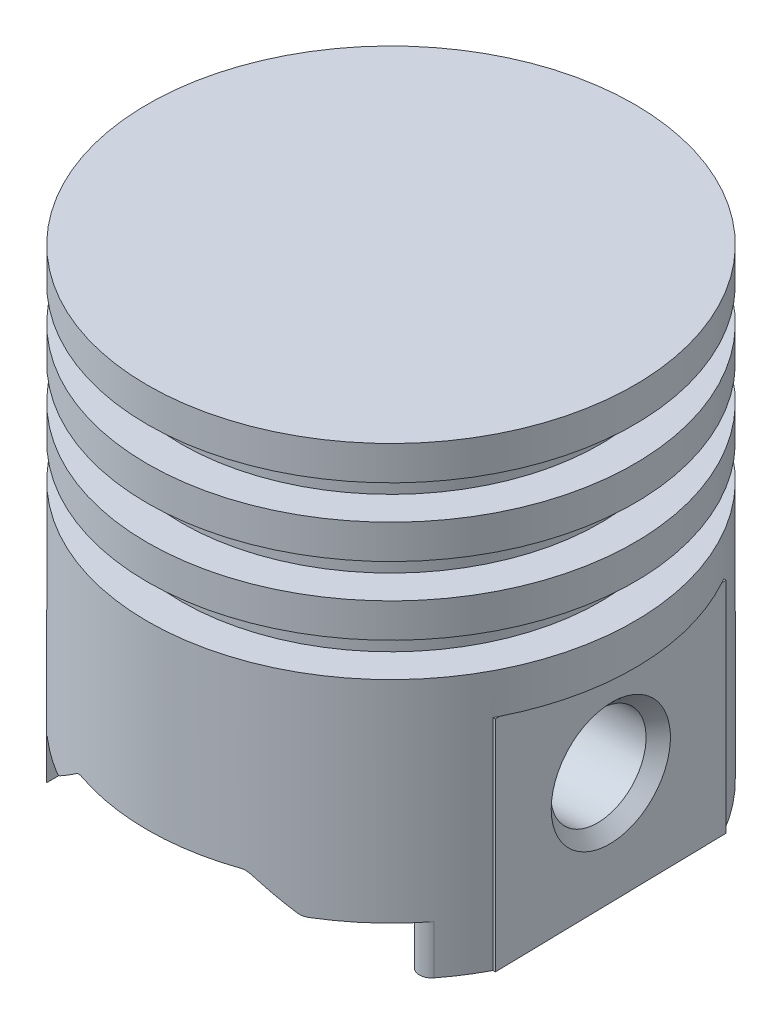
from build123d import *

# Parameters (mm, degrees)
SKETCH2_R               = 85
CUT_EXTRUDE2_DEPTH      = 93
BOSS_EXTRUDE1_START     = 85
SKETCH3_R               = 85
BOSS_EXTRUDE1_DEPTH     = 85
CUT_EXTRUDE3_DEPTH      = 174.061825504
CUT_EXTRUDE3_DEPTH_BACK = 174.061825504
BOSS_EXTRUDE2_DEPTH     = 95.654206
CUT_EXTRUDE7_START      = -90
CUT_EXTRUDE7_DEPTH      = 90
SKETCH11_R              = 25
BOSS_EXTRUDE3_DEPTH     = 90
SKETCH12_W              = 96.789265928
SKETCH12_H              = 90
BOSS_EXTRUDE4_DEPTH     = 1
SKETCH13_W              = 96.789265928
SKETCH13_H              = 90
BOSS_EXTRUDE5_DEPTH     = 1
CUT_EXTRUDE8_START      = -175.541269129
SKETCH14_R              = 20
CUT_EXTRUDE8_DEPTH      = 176.541269129
SKETCH16_R              = 30.208811045
SKETCH16_R_2            = 17.877643793
CUT_EXTRUDE10_DEPTH     = 40
CUT_EXTRUDE11_START     = -64
SKETCH17_R              = 20
CUT_EXTRUDE11_DEPTH     = 64
FILLET1_R               = 10
FILLET3_R               = 5
CHAMFER1_SIZE           = 5


with BuildPart() as part:
    # Revolve-Thin1: read off the stored shape, not the designer's step
    # Revolve-Thin1 outline → Revolve-Thin1 (revolve)
    with BuildSketch(Plane.XY):
        Polygon((0, -89.751668892), (0, -99.751668892), (100, -99.751668892), (100, 6.902536716), (86, 6.902536716), (86, 20.902536716), (100, 20.902536716), (100, 34.902536716), (86, 34.902536716), (86, 48.902536716), (100, 48.902536716), (100, 62.902536716), (86, 62.902536716), (86, 76.902536716), (100, 76.902536716), (100, 90.902536716), (0, 90.902536716), (0, 80.902536716), (76, 80.902536716), (76, -3.097463284), (90, -3.097463284), (90, -89.751668892), align=None)
    revolve(axis=Axis((0, 0, 0), (0, 1, 0)))

    # Sketch2 → Cut-Extrude2 (cut)
    with BuildSketch(Plane.XZ.offset(99.751668892)):
        with Locations(Location((0, 0, 0), (0, 0, 270))):
            Circle(SKETCH2_R)
    extrude(amount=-CUT_EXTRUDE2_DEPTH, mode=Mode.SUBTRACT)

    # Sketch3 → Boss-Extrude1 (add)
    with BuildSketch(Plane.XZ.offset(-80.902536716).offset(BOSS_EXTRUDE1_START)):
        with Locations(Location((0, 0, 0), (0, 0, 270))):
            Circle(SKETCH3_R)
    extrude(amount=-BOSS_EXTRUDE1_DEPTH)

    # Sketch4 → Cut-Extrude3 (cut, two sides: drawn at the far end of the back side and taken through both)
    with BuildSketch(Plane.XY.offset(-CUT_EXTRUDE3_DEPTH_BACK)):
        Polygon((-70, -99.751668892), (70, -99.751668892), (70, -79.751668892), (50, -79.751668892), (34.353026326, -67.294854899), (-34.353026326, -67.294854899), (-50, -79.751668892), (-70, -79.751668892), align=None)
    extrude(amount=CUT_EXTRUDE3_DEPTH + CUT_EXTRUDE3_DEPTH_BACK, mode=Mode.SUBTRACT)

    # Sketch7 → Boss-Extrude2 (add, through all)
    with BuildSketch(Plane.XZ.offset(4.097463284)):
        with BuildLine():
            Line((-70, 48.218253805), (-70, -48.218253805))
            ThreePointArc((-70, -48.218253805), (-85, 0), (-70, 48.218253805))
        make_face()
        with BuildLine():
            Line((70, 48.218253805), (70, -48.218253805))
            ThreePointArc((70, -48.218253805), (85, 0), (70, 48.218253805))
        make_face()
    extrude(amount=BOSS_EXTRUDE2_DEPTH)

    # Sketch9 → Cut-Extrude7 (cut)
    with BuildSketch(Plane.XZ.offset(99.751668892).offset(CUT_EXTRUDE7_START)):
        with BuildLine():
            Line((-88.474503893, 46.607533307), (-86.50893928, -50.161772544))
            ThreePointArc((-86.50893928, -50.161772544), (-99.979377798, -2.030767146), (-88.474503893, 46.607533307))
        make_face()
        with BuildLine():
            Line((88.474503893, 46.607533307), (86.50893928, -50.161772544))
            ThreePointArc((86.50893928, -50.161772544), (99.979377798, -2.030767146), (88.474503893, 46.607533307))
        make_face()
    extrude(amount=CUT_EXTRUDE7_DEPTH, mode=Mode.SUBTRACT)

    # Sketch11 → Boss-Extrude3 (add)
    with BuildSketch(Plane(origin=(87.491721586, 0, -1.777119618), x_dir=(-0.02030767145531355, 0, -0.99979377797627), z_dir=(0.9997937779762701, 0, -0.02030767145531355))):
        with Locations((0, -54.751668892)):
            Circle(SKETCH11_R)
    boss_extrude3 = extrude(amount=-BOSS_EXTRUDE3_DEPTH)

    # Sketch12 → Boss-Extrude4 (add)
    with BuildSketch(Plane(origin=(87.491721586, 0, -1.777119618), x_dir=(-0.02030767145531355, 0, -0.99979377797627), z_dir=(0.9997937779762701, 0, -0.02030767145531355))):
        with Locations((0, -54.751668892)):
            Rectangle(SKETCH12_W, SKETCH12_H)
    boss_extrude4 = extrude(amount=BOSS_EXTRUDE4_DEPTH)

    # Sketch13 → Boss-Extrude5 (add)
    with BuildSketch(Plane(origin=(-87.491721586, 0, -1.777119618), x_dir=(-0.02030767145531355, 0, 0.99979377797627), z_dir=(-0.9997937779762701, 0, -0.02030767145531355))):
        with Locations((0, -54.751668892)):
            Rectangle(SKETCH13_W, SKETCH13_H)
    boss_extrude5 = extrude(amount=BOSS_EXTRUDE5_DEPTH)

    # Sketch14 → Cut-Extrude8 (cut)
    with BuildSketch(Plane(origin=(-2.489718432, 0, 0.050570813), x_dir=(0.020307671455313554, 0, 0.99979377797627), z_dir=(-0.9997937779762701, 0, 0.020307671455313554)).offset(CUT_EXTRUDE8_START)):
        with Locations((0, -53.701162377)):
            Circle(SKETCH14_R)
    cut_extrude8 = extrude(amount=CUT_EXTRUDE8_DEPTH, mode=Mode.SUBTRACT)

    # Sketch16 → Cut-Extrude10 (cut)
    with BuildSketch(Plane(origin=(-2.489718432, 0, 0.050570813), x_dir=(0.020307671455313554, 0, 0.99979377797627), z_dir=(-0.9997937779762701, 0, 0.020307671455313554))):
        with Locations((0, -53.701162377)):
            Circle(SKETCH16_R)
        with Locations((0, -53.701162377)):
            Circle(SKETCH16_R_2, mode=Mode.SUBTRACT)
    cut_extrude10 = extrude(amount=-CUT_EXTRUDE10_DEPTH, mode=Mode.SUBTRACT)

    # Mirror3: Boss-Extrude3, Boss-Extrude4, Boss-Extrude5, Cut-Extrude8, Cut-Extrude10 across plane
    add(boss_extrude3.mirror(Plane(origin=(0, 0, 0), x_dir=(0, 0, 1), z_dir=(1, 0, 0))))
    add(boss_extrude4.mirror(Plane(origin=(0, 0, 0), x_dir=(0, 0, 1), z_dir=(1, 0, 0))))
    add(boss_extrude5.mirror(Plane(origin=(0, 0, 0), x_dir=(0, 0, 1), z_dir=(1, 0, 0))))
    add(cut_extrude8.mirror(Plane(origin=(0, 0, 0), x_dir=(0, 0, 1), z_dir=(1, 0, 0))), mode=Mode.SUBTRACT)
    add(cut_extrude10.mirror(Plane(origin=(0, 0, 0), x_dir=(0, 0, 1), z_dir=(1, 0, 0))), mode=Mode.SUBTRACT)

    # Sketch17 → Cut-Extrude11 (cut)
    with BuildSketch(Plane(origin=(37.502032687, 0, -0.761736045), x_dir=(0.020307671455313557, 0, 0.99979377797627), z_dir=(-0.9997937779762701, 0, 0.020307671455313557)).offset(CUT_EXTRUDE11_START)):
        with Locations((0, -53.701162377)):
            Circle(SKETCH17_R)
    extrude(amount=CUT_EXTRUDE11_DEPTH, mode=Mode.SUBTRACT)

    # Fillet1
    fillet1_edges = [part.edges().sort_by_distance(p)[0] for p in [
        (70, -54.751668892, 23.583326399),
        (-70, -54.751668892, 23.583326399),
    ]]
    fillet(fillet1_edges, radius=FILLET1_R)

    # Fillet3
    # the kernel refuses this fillet: 5 mm, written as the material it adds along each edge
    with BuildSketch(Plane(origin=(-70, -79.751668892, 83.914284285), x_dir=(1, 0, 0), z_dir=(0, 0, -1))) as fillet3_piece_1_section:
        with BuildLine():
            CenterArc((FILLET3_R, FILLET3_R), FILLET3_R, 180, 90)
            Line((0, FILLET3_R), (0, 0))
            Line((0, 0), (FILLET3_R, 0))
        make_face()
    fillet3_piece_1 = extrude(amount=39.845741791, mode=Mode.PRIVATE)
    fillet3_piece_1 = fillet3_piece_1 & Plane(origin=(0, -79.751668892, 0), x_dir=(1, 0, 0), z_dir=(0, 1, 0)) * Cylinder(100, 100, mode=Mode.PRIVATE)
    fillet3_piece_1 = fillet3_piece_1 - Plane(origin=(0, -79.751668892, 0), x_dir=(1, 0, 0), z_dir=(0, -1, 0)) * Cylinder(90, 100, mode=Mode.PRIVATE)
    add(fillet3_piece_1)
    with BuildSketch(Plane(origin=(-70, -79.751668892, -44.068542495), x_dir=(0, -1, 0), z_dir=(0, 0, -1))) as fillet3_piece_2_section:
        with BuildLine():
            CenterArc((FILLET3_R, -FILLET3_R), FILLET3_R, 90, 90)
            Line((0, -FILLET3_R), (0, 0))
            Line((0, 0), (FILLET3_R, 0))
        make_face()
    fillet3_piece_2 = extrude(amount=39.845741791, mode=Mode.PRIVATE)
    fillet3_piece_2 = fillet3_piece_2 & Plane(origin=(0, -79.751668892, 0), x_dir=(1, 0, 0), z_dir=(0, 1, 0)) * Cylinder(100, 100, mode=Mode.PRIVATE)
    fillet3_piece_2 = fillet3_piece_2 - Plane(origin=(0, -79.751668892, 0), x_dir=(1, 0, 0), z_dir=(0, -1, 0)) * Cylinder(90, 100, mode=Mode.PRIVATE)
    add(fillet3_piece_2)
    with BuildSketch(Plane(origin=(-34.353026326, -67.294854899, -98.282278363), x_dir=(-0.7823486836917977, -0.6228406996381269, 0), z_dir=(0, 0, 1))) as fillet3_piece_3_section:
        with BuildLine():
            CenterArc((FILLET3_R * 0.34944941208, FILLET3_R), FILLET3_R, 231.476124538, 38.523875462)
            Line((-FILLET3_R * 0.273391287558, FILLET3_R * 0.217651316308), (0, 0))
            Line((0, 0), (FILLET3_R * 0.34944941208, 0))
        make_face()
    fillet3_piece_3 = extrude(amount=19.464642533, mode=Mode.PRIVATE)
    fillet3_piece_3 = fillet3_piece_3 & Plane(origin=(0, -67.294854899, 0), x_dir=(1, 0, 0), z_dir=(0, 1, 0)) * Cylinder(100, 46, mode=Mode.PRIVATE)
    fillet3_piece_3 = fillet3_piece_3 - Plane(origin=(0, -67.294854899, 0), x_dir=(1, 0, 0), z_dir=(0, -1, 0)) * Cylinder(90, 46, mode=Mode.PRIVATE)
    add(fillet3_piece_3)
    with BuildSketch(Plane(origin=(-34.353026326, -67.294854899, 78.81763583), x_dir=(1, 0, 0), z_dir=(0, 0, 1))) as fillet3_piece_4_section:
        with BuildLine():
            CenterArc((FILLET3_R * 0.34944941208, -FILLET3_R), FILLET3_R, 90, 38.523875462)
            Line((-FILLET3_R * 0.273391287558, -FILLET3_R * 0.217651316308), (0, 0))
            Line((0, 0), (FILLET3_R * 0.34944941208, 0))
        make_face()
    fillet3_piece_4 = extrude(amount=19.464642533, mode=Mode.PRIVATE)
    fillet3_piece_4 = fillet3_piece_4 & Plane(origin=(0, -67.294854899, 0), x_dir=(1, 0, 0), z_dir=(0, 1, 0)) * Cylinder(100, 46, mode=Mode.PRIVATE)
    fillet3_piece_4 = fillet3_piece_4 - Plane(origin=(0, -67.294854899, 0), x_dir=(1, 0, 0), z_dir=(0, -1, 0)) * Cylinder(90, 46, mode=Mode.PRIVATE)
    add(fillet3_piece_4)
    with BuildSketch(Plane(origin=(34.353026326, -67.294854899, -98.282278363), x_dir=(-1, 0, 0), z_dir=(0, 0, 1))) as fillet3_piece_5_section:
        with BuildLine():
            CenterArc((FILLET3_R * 0.34944941208, FILLET3_R), FILLET3_R, 231.476124538, 38.523875462)
            Line((-FILLET3_R * 0.273391287558, FILLET3_R * 0.217651316308), (0, 0))
            Line((0, 0), (FILLET3_R * 0.34944941208, 0))
        make_face()
    fillet3_piece_5 = extrude(amount=19.464642533, mode=Mode.PRIVATE)
    fillet3_piece_5 = fillet3_piece_5 & Plane(origin=(0, -67.294854899, 0), x_dir=(1, 0, 0), z_dir=(0, 1, 0)) * Cylinder(100, 46, mode=Mode.PRIVATE)
    fillet3_piece_5 = fillet3_piece_5 - Plane(origin=(0, -67.294854899, 0), x_dir=(1, 0, 0), z_dir=(0, -1, 0)) * Cylinder(90, 46, mode=Mode.PRIVATE)
    add(fillet3_piece_5)
    with BuildSketch(Plane(origin=(34.353026326, -67.294854899, 78.81763583), x_dir=(0.7823486836917984, -0.6228406996381259, 0), z_dir=(0, 0, 1))) as fillet3_piece_6_section:
        with BuildLine():
            CenterArc((FILLET3_R * 0.34944941208, -FILLET3_R), FILLET3_R, 90, 38.523875462)
            Line((-FILLET3_R * 0.273391287558, -FILLET3_R * 0.217651316308), (0, 0))
            Line((0, 0), (FILLET3_R * 0.34944941208, 0))
        make_face()
    fillet3_piece_6 = extrude(amount=19.464642533, mode=Mode.PRIVATE)
    fillet3_piece_6 = fillet3_piece_6 & Plane(origin=(0, -67.294854899, 0), x_dir=(1, 0, 0), z_dir=(0, 1, 0)) * Cylinder(100, 46, mode=Mode.PRIVATE)
    fillet3_piece_6 = fillet3_piece_6 - Plane(origin=(0, -67.294854899, 0), x_dir=(1, 0, 0), z_dir=(0, -1, 0)) * Cylinder(90, 46, mode=Mode.PRIVATE)
    add(fillet3_piece_6)
    with BuildSketch(Plane(origin=(70, -79.751668892, -83.914284285), x_dir=(0, -1, 0), z_dir=(0, 0, 1))) as fillet3_piece_7_section:
        with BuildLine():
            CenterArc((FILLET3_R, -FILLET3_R), FILLET3_R, 90, 90)
            Line((0, -FILLET3_R), (0, 0))
            Line((0, 0), (FILLET3_R, 0))
        make_face()
    fillet3_piece_7 = extrude(amount=39.845741791, mode=Mode.PRIVATE)
    fillet3_piece_7 = fillet3_piece_7 & Plane(origin=(0, -79.751668892, 0), x_dir=(1, 0, 0), z_dir=(0, 1, 0)) * Cylinder(100, 100, mode=Mode.PRIVATE)
    fillet3_piece_7 = fillet3_piece_7 - Plane(origin=(0, -79.751668892, 0), x_dir=(1, 0, 0), z_dir=(0, -1, 0)) * Cylinder(90, 100, mode=Mode.PRIVATE)
    add(fillet3_piece_7)
    # the kernel refuses this fillet: 5 mm, written as the material it takes off along each edge
    with BuildSketch(Plane(origin=(70, -133.364682754, 71.414284285), x_dir=(0, 0, -1), z_dir=(0, 1, 0))) as fillet3_2_piece_1:
        with BuildLine():
            CenterArc((13.104765337, -5), FILLET3_R, 90, 142.136353638)
            ThreePointArc((10.035843287, -8.947368421), (4.867377351, -4.642542678), (0, 0))
            Line((0, 0), (13.104765337, 0))
        make_face()
    extrude(amount=53.613013862, mode=Mode.SUBTRACT)
    with BuildSketch(Plane(origin=(-50, -79.751668892, 90.970658029), x_dir=(0.7823486836917969, 0.6228406996381279, 0), z_dir=(0, 0, -1)), Plane(origin=(50, -79.751668892, -90.970658029), x_dir=(-0.7823486836917977, 0.6228406996381269, 0), z_dir=(0, 0, 1))) as fillet3_2_piece_2:
        with BuildLine():
            CenterArc((FILLET3_R * 0.34944941208, -FILLET3_R), FILLET3_R, 90, 38.523875462)
            Line((-FILLET3_R * 0.273391287558, -FILLET3_R * 0.217651316308), (0, 0))
            Line((0, 0), (FILLET3_R * 0.34944941208, 0))
        make_face()
    extrude(amount=20.505627945, mode=Mode.SUBTRACT)
    with BuildSketch(Plane(origin=(-50, -79.751668892, -70.465030084), x_dir=(-1, 0, 0), z_dir=(0, 0, -1)), Plane(origin=(50, -79.751668892, 70.465030084), x_dir=(1, 0, 0), z_dir=(0, 0, 1))) as fillet3_2_piece_3:
        with BuildLine():
            CenterArc((FILLET3_R * 0.34944941208, FILLET3_R), FILLET3_R, 231.476124538, 38.523875462)
            Line((-FILLET3_R * 0.273391287558, FILLET3_R * 0.217651316308), (0, 0))
            Line((0, 0), (FILLET3_R * 0.34944941208, 0))
        make_face()
    extrude(amount=20.505627945, mode=Mode.SUBTRACT)

    # Chamfer1
    chamfer1_edges = [part.edges().sort_by_distance(p)[0] for p in [
        (-88.085361935, -53.701162377, -21.793302849),
        (88.085361935, -53.701162377, -21.793302849),
    ]]
    chamfer(chamfer1_edges, length=CHAMFER1_SIZE)


solid = part.part
